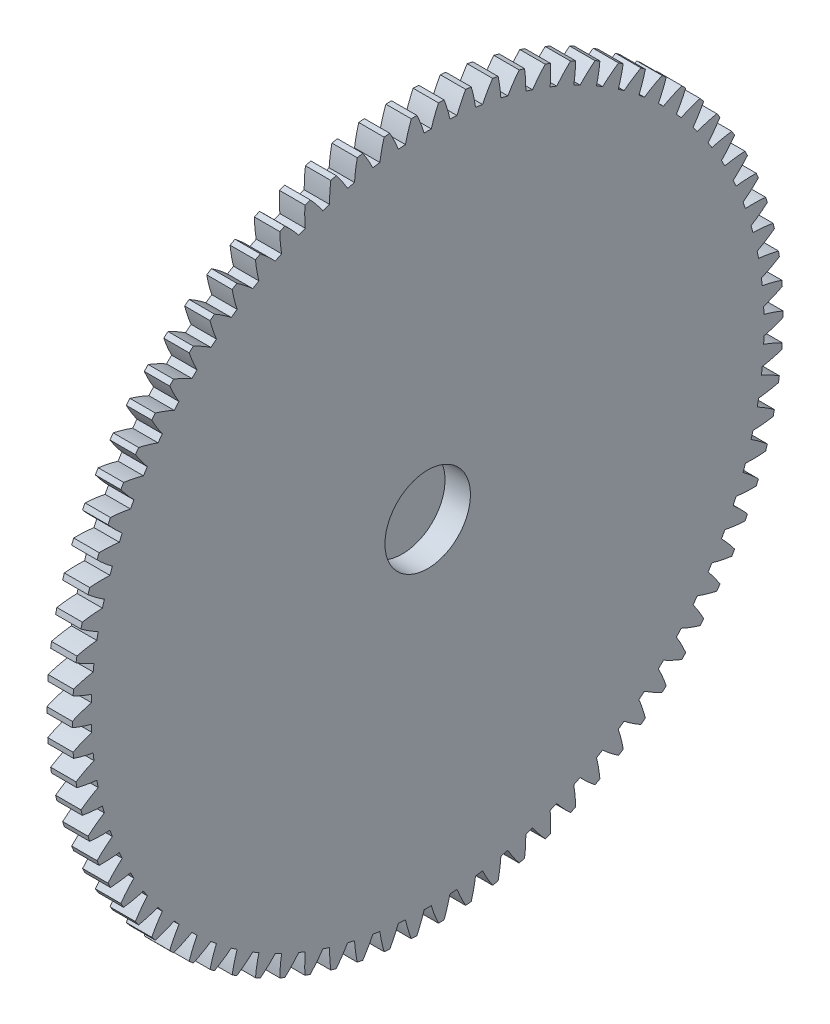
from build123d import *

# Parameters (mm, degrees)
BASPROSKE_W         = 3
BASPROSKE_H         = 42
TOOTHCUT_DEPTH      = 60.472682805
TEETHCUTS_COUNT     = 82
BORSKE_R            = 3
BORE_DEPTH          = 50.0000508
SKETCH1_R           = 3
BOSS_EXTRUDE1_DEPTH = 3
CUT_EXTRUDE1_REACH  = 61.459
CUT_EXTRUDE2_REACH  = 61.459
SKETCH3_R           = 3
SKETCH4_R           = 5.05
CUT_EXTRUDE3_DEPTH  = 60.458938074
BOSS_EXTRUDE2_START = 12.85
SKETCH5_R           = 5.05
BOSS_EXTRUDE2_DEPTH = 12.85
BOSS_EXTRUDE3_DEPTH = 5.05


with BuildPart() as part:
    # BasProSke → Base-Revolve (revolve)
    with BuildSketch(Plane(origin=(0, 0, 0), x_dir=(1, 0, 0), z_dir=(0, 1, 0)), mode=Mode.PRIVATE) as base_revolve_sk:
        with Locations((1.5, 21)):
            Rectangle(BASPROSKE_W, BASPROSKE_H)
    revolve(base_revolve_sk.sketch.rotate(Axis((-10, 0, 0), (1, 0, 0)), 180), axis=Axis((-10, 0, 0), (1, 0, 0)))

    # TooCutSke → ToothCut (cut, through all)
    with BuildSketch(Plane(origin=(0, 0, 0), x_dir=(0, 0, -1), z_dir=(1, 0, 0))):
        with BuildLine():
            ThreePointArc((0.41984386, 39.746782664), (0, 39.749), (-0.41984386, 39.746782664))
            ThreePointArc((-0.41984386, 39.746782664), (-0.813371958, 40.892267765), (-1.290367262, 42.005585313))
            ThreePointArc((-1.290367262, 42.005585313), (0, 42.0254), (1.290367262, 42.005585313))
            ThreePointArc((1.290367262, 42.005585313), (0.813371958, 40.892267765), (0.41984386, 39.746782664))
        make_face()
    toothcut = extrude(amount=TOOTHCUT_DEPTH, mode=Mode.SUBTRACT)

    # TeethCuts: ToothCut ×82 about axis
    teethcuts_axis = Axis((0, 0, 0), (1, 0, 0))
    for i in range(1, TEETHCUTS_COUNT):
        add(toothcut.rotate(teethcuts_axis, i * 360 / TEETHCUTS_COUNT), mode=Mode.SUBTRACT)

    # BorSke → Bore (cut, symmetric)
    with BuildSketch(Plane(origin=(0, 0, 0), x_dir=(0, 0, -1), z_dir=(1, 0, 0))):
        with Locations(Location((0, 0, 0), (0, 0, 180))):
            Circle(BORSKE_R)
    extrude(amount=BORE_DEPTH, both=True, mode=Mode.SUBTRACT)

    # Sketch1 → Boss-Extrude1 (add)
    with BuildSketch(Plane(origin=(3, 0, 0), x_dir=(0, 0, -1), z_dir=(1, 0, 0))):
        Circle(SKETCH1_R)
    extrude(amount=-BOSS_EXTRUDE1_DEPTH)

    # Sketch2 → Cut-Extrude1 (cut, up to next)
    with BuildSketch(Plane(origin=(3, 0, 0), x_dir=(0, 0, -1), z_dir=(1, 0, 0)), mode=Mode.PRIVATE) as cut_extrude1_sk1:
        with BuildLine():
            ThreePointArc((1.8, 2.01246118), (0, 2.7), (-1.8, 2.01246118))
            Line((-1.8, 2.01246118), (-1.8, 0))
            Line((-1.8, 0), (1.8, 0))
            Line((1.8, 0), (1.8, 2.01246118))
        make_face()
    cut_extrude1_tool1 = extrude(cut_extrude1_sk1.sketch, amount=-CUT_EXTRUDE1_REACH, mode=Mode.PRIVATE) & part.part
    # Sketch2 → Cut-Extrude1 (cut, up to next)
    with BuildSketch(Plane(origin=(3, 0, 0), x_dir=(0, 0, -1), z_dir=(1, 0, 0)), mode=Mode.PRIVATE) as cut_extrude1_sk2:
        with BuildLine():
            Line((1.8, 0), (-1.8, 0))
            Line((-1.8, 0), (-1.8, -2.01246118))
            ThreePointArc((-1.8, -2.01246118), (0, -2.7), (1.8, -2.01246118))
            Line((1.8, -2.01246118), (1.8, 0))
        make_face()
    cut_extrude1_tool2 = extrude(cut_extrude1_sk2.sketch, amount=-CUT_EXTRUDE1_REACH, mode=Mode.PRIVATE) & part.part
    # Sketch2 → Cut-Extrude1 (cut, up to next)
    with BuildSketch(Plane(origin=(3, 0, 0), x_dir=(0, 0, -1), z_dir=(1, 0, 0)), mode=Mode.PRIVATE) as cut_extrude1_sk3:
        with BuildLine():
            ThreePointArc((1.8, 2.01246118), (0, 2.7), (-1.8, 2.01246118))
            Line((-1.8, 2.01246118), (-1.8, 0))
            Line((-1.8, 0), (1.8, 0))
            Line((1.8, 0), (1.8, 2.01246118))
        make_face()
    cut_extrude1_tool3 = extrude(cut_extrude1_sk3.sketch, amount=-CUT_EXTRUDE1_REACH, mode=Mode.PRIVATE) & part.part
    # Sketch2 → Cut-Extrude1 (cut, up to next)
    with BuildSketch(Plane(origin=(3, 0, 0), x_dir=(0, 0, -1), z_dir=(1, 0, 0)), mode=Mode.PRIVATE) as cut_extrude1_sk4:
        with BuildLine():
            Line((1.8, 0), (-1.8, 0))
            Line((-1.8, 0), (-1.8, -2.01246118))
            ThreePointArc((-1.8, -2.01246118), (0, -2.7), (1.8, -2.01246118))
            Line((1.8, -2.01246118), (1.8, 0))
        make_face()
    cut_extrude1_tool4 = extrude(cut_extrude1_sk4.sketch, amount=-CUT_EXTRUDE1_REACH, mode=Mode.PRIVATE) & part.part
    add(cut_extrude1_tool1.solids().sort_by_distance((3, 1.250036, 0))[0], mode=Mode.SUBTRACT)
    add(cut_extrude1_tool2.solids().sort_by_distance((3, -1.250036, 0))[0], mode=Mode.SUBTRACT)
    add(cut_extrude1_tool3.solids().sort_by_distance((3, 1.250036, 0))[0], mode=Mode.SUBTRACT)
    add(cut_extrude1_tool4.solids().sort_by_distance((3, -1.250036, 0))[0], mode=Mode.SUBTRACT)

    # Sketch3 → Cut-Extrude2 (cut, up to next)
    with BuildSketch(Plane(origin=(3, 0, 0), x_dir=(0, 0, -1), z_dir=(1, 0, 0)), mode=Mode.PRIVATE) as cut_extrude2_sk1:
        Circle(SKETCH3_R)
    cut_extrude2_tool1 = extrude(cut_extrude2_sk1.sketch, amount=-CUT_EXTRUDE2_REACH, mode=Mode.PRIVATE) & part.part
    add(cut_extrude2_tool1.solids().sort_by_distance((3, 0, 0))[0], mode=Mode.SUBTRACT)

    # Sketch4 → Cut-Extrude3 (cut, through all)
    with BuildSketch(Plane.ZY):
        Circle(SKETCH4_R)
    extrude(amount=-CUT_EXTRUDE3_DEPTH, mode=Mode.SUBTRACT)

    # Sketch5 → Boss-Extrude2 (add)
    with BuildSketch(Plane.ZY.offset(BOSS_EXTRUDE2_START)):
        Polygon((6.298876746, -3.581198832), (6.250847537, 3.664387861), (-0.048029208, 7.245586693), (-6.298876746, 3.581198832), (-6.250847537, -3.664387861), (0.048029208, -7.245586693), align=None)
        Circle(SKETCH5_R, mode=Mode.SUBTRACT)
    extrude(amount=-BOSS_EXTRUDE2_DEPTH)

    # Sketch6 → Boss-Extrude3 (add)
    with BuildSketch(Plane.ZY):
        Polygon((0.055683265, -8.400261863), (7.302681805, -4.151907809), (7.246998539, 4.248354054), (-0.055683265, 8.400261863), (-7.302681805, 4.151907809), (-7.246998539, -4.248354054), align=None)
    extrude(amount=BOSS_EXTRUDE3_DEPTH)


solid = part.part
